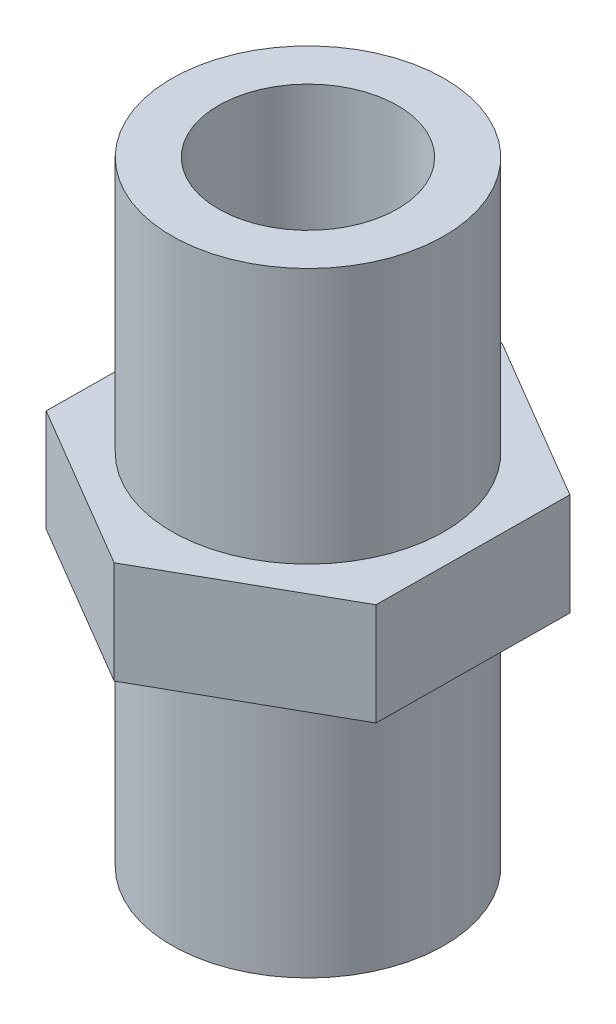
from build123d import *

# Parameters (mm, degrees)
SKETCH1_R               = 10.65
BOSS_EXTRUDE1_DEPTH     = 24
BOSS_EXTRUDE2_DEPTH     = 4
CUT_EXTRUDE1_DEPTH      = 52.962056715
CUT_EXTRUDE1_DEPTH_BACK = 52.962056715
SKETCH3_R               = 7
FILLET1_R               = 6


with BuildPart() as part:
    # Sketch1 → Boss-Extrude1 (new, symmetric)
    with BuildSketch(Plane(origin=(0, 0, 0), x_dir=(1, 0, 0), z_dir=(0, 1, 0))):
        with Locations(Location((0, 0, 0), (0, 0, 270))):
            Circle(SKETCH1_R)
    extrude(amount=BOSS_EXTRUDE1_DEPTH, both=True)

    # Sketch2 → Boss-Extrude2 (add, symmetric)
    with BuildSketch(Plane(origin=(0, 0, 0), x_dir=(1, 0, 0), z_dir=(0, 1, 0))):
        Polygon((13.066755915, 7.388722704), (0.134556394, 15.010503919), (-12.932199521, 7.621781215), (-13.066755915, -7.388722704), (-0.134556394, -15.010503919), (12.932199521, -7.621781215), align=None)
    extrude(amount=BOSS_EXTRUDE2_DEPTH, both=True)

    # Sketch3 → Cut-Extrude1 (cut, two sides: drawn at the far end of the back side and taken through both)
    with BuildSketch(Plane(origin=(0, 24, 0), x_dir=(1, 0, 0), z_dir=(0, 1, 0)).offset(-CUT_EXTRUDE1_DEPTH_BACK)):
        with Locations(Location((0, 0, 0), (0, 0, 270))):
            Circle(SKETCH3_R)
    extrude(amount=CUT_EXTRUDE1_DEPTH + CUT_EXTRUDE1_DEPTH_BACK, mode=Mode.SUBTRACT)

    # Fillet1
    # the kernel refuses this fillet: 6 mm, written as the material it takes off along each edge
    with BuildSketch(Plane(origin=(0, -24, 0), x_dir=(0, 0, 1), z_dir=(-1, 0, 0))) as fillet1_piece_1:
        with BuildLine():
            CenterArc((13, 5.520643078), FILLET1_R, 180, 66.941755912)
            Line((7, 5.520643078), (6.88, 5.520643078))
            Line((6.88, 5.520643078), (6.88, 0))
            Line((6.88, 0), (7, -0.12))
            ThreePointArc((7, -0.12), (8.825, -0.12), (10.603, -0.110412862))
            Line((10.603, -0.110412862), (10.65, 0))
        make_face()
    revolve(axis=Axis((0, -24, 0), (0, 1, 0)), mode=Mode.SUBTRACT)


solid = part.part
